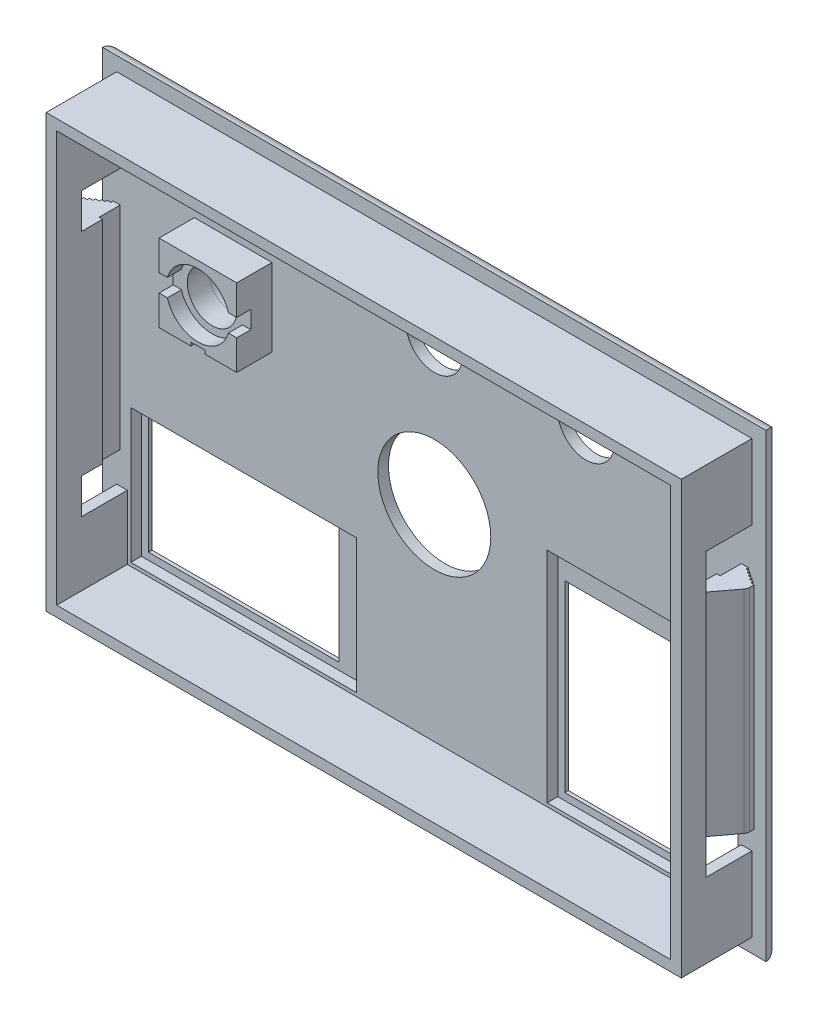
from build123d import *

# Parameters (mm, degrees)
SKETCH_1_W             = 94
SKETCH_1_H             = 65.2
EXTRUDE_1_DEPTH        = 2
SKETCH_2_R             = 8
SKETCH_2_R_2           = 3.5
SKETCH_2_R_3           = 4
SKETCH_2_W             = 27
SKETCH_2_H             = 17
SKETCH_2_W_2           = 25
SKETCH_2_H_2           = 26
CUT_EXTRUDE_1_DEPTH    = 2
SKETCH_3_W             = 90
SKETCH_3_H             = 61.2
SKETCH_3_W_2           = 86
SKETCH_3_H_2           = 57.2
EXTRUDE_2_DEPTH        = 10
SKETCH_4_R             = 9
SKETCH_4_R_2           = 5
CUT_EXTRUDE_4_DEPTH    = 0.5
SKETCH_5_W             = 27
SKETCH_5_H             = 31
SKETCH_5_W_2           = 32
SKETCH_5_H_2           = 19
CUT_EXTRUDE_5_DEPTH    = 1.5
SKETCH_6_W             = 12
SKETCH_6_H             = 12
SKETCH_6_R             = 3.5
EXTRUDE_4_DEPTH        = 5
SKETCH_7_W             = 2
SKETCH_7_H             = 1
CUT_EXTRUDE_6_DEPTH    = 3
CUT_EXTRUDE_7_DEPTH    = 2
SKETCH_10_W            = 6
SKETCH_10_H            = 30
EXTRUDE_5_DEPTH        = 3
CUT_EXTRUDE_9_DEPTH    = 30
CUT_EXTRUDE_10_DEPTH   = 30
CUT_EXTRUDE_11_DEPTH   = 30
FILLET_1_R             = 1
FILLET_2_R             = 2
FILLET_1_OF_MIRROR_9_R = 1
SKETCH_17_R            = 4.5
CUT_EXTRUDE_13_DEPTH   = 2
SKETCH_18_W            = 1.677095884
SKETCH_18_H            = 2.5
CUT_EXTRUDE_14_DEPTH   = 2
SKETCH_19_W            = 1
SKETCH_19_H            = 3
CUT_EXTRUDE_15_DEPTH   = 30
SKETCH_21_W            = 87
SKETCH_21_H            = 58.2
SKETCH_21_W_2          = 86
SKETCH_21_H_2          = 57.2
CUT_EXTRUDE_27_DEPTH   = 10
CUT_EXTRUDE_START      = -7
SKETCH_24_W            = 12
SKETCH_24_H            = 12
SKETCH_24_W_2          = 11
SKETCH_24_H_2          = 11
CUT_EXTRUDE_28_DEPTH   = 7


with BuildPart() as part:
    # 草图1 → 凸台-拉伸1 (new body)
    with BuildSketch(Plane.XY):
        Rectangle(SKETCH_1_W, SKETCH_1_H)
    extrude(amount=EXTRUDE_1_DEPTH)

    # 草图2 → 切除-拉伸1 (cut)
    with BuildSketch(Plane.XY.offset(2)):
        Circle(SKETCH_2_R)
        with Locations((-28.5, 12.7)):
            Circle(SKETCH_2_R_2)
        with Locations((37.5, 20.2)):
            Circle(SKETCH_2_R_3)
        with Locations((21.5, 20.2)):
            Circle(SKETCH_2_R_3)
        with Locations((0, 20.2)):
            Circle(SKETCH_2_R_3)
        with Locations((-28.5, -19.1)):
            Rectangle(SKETCH_2_W, SKETCH_2_H)
        with Locations((29.5, -14.6)):
            Rectangle(SKETCH_2_W_2, SKETCH_2_H_2)
    extrude(amount=-CUT_EXTRUDE_1_DEPTH, mode=Mode.SUBTRACT)

    # 草图3 → 凸台-拉伸2 (add)
    with BuildSketch(Plane.XY.offset(2)):
        Rectangle(SKETCH_3_W, SKETCH_3_H)
        Rectangle(SKETCH_3_W_2, SKETCH_3_H_2, mode=Mode.SUBTRACT)
    extrude(amount=EXTRUDE_2_DEPTH)

    # 草图4 → 切除-拉伸4 (cut)
    with BuildSketch(Plane(origin=(0, 0, 0), x_dir=(-1, 0, 0), z_dir=(0, 0, -1))):
        Circle(SKETCH_4_R)
        with Locations((0, 20.2)):
            Circle(SKETCH_4_R_2)
        with Locations((-21.5, 20.2)):
            Circle(SKETCH_4_R_2)
        with Locations((-37.5, 20.2)):
            Circle(SKETCH_4_R_2)
    extrude(amount=-CUT_EXTRUDE_4_DEPTH, mode=Mode.SUBTRACT)

    # 草图5 → 切除-拉伸5 (cut)
    with BuildSketch(Plane.XY.offset(2)):
        with Locations((29.5, -13.1)):
            Rectangle(SKETCH_5_W, SKETCH_5_H)
        with Locations((-27, -19.1)):
            Rectangle(SKETCH_5_W_2, SKETCH_5_H_2)
    extrude(amount=-CUT_EXTRUDE_5_DEPTH, mode=Mode.SUBTRACT)

    # 草图9 → 切除-拉伸7 (cut)
    with BuildSketch(Plane(origin=(45, 0, 0), x_dir=(0, 0, -1), z_dir=(1, 0, 0))):
        Polygon((-8.5, 20), (-8.5, 15), (-2.5, 15), (-2.5, -15), (-8.5, -15), (-8.5, -20), (-4.518745162, -20), (-2, -20), (-2, 20), align=None)
    cut_extrude_7 = extrude(amount=-CUT_EXTRUDE_7_DEPTH, mode=Mode.SUBTRACT)

    # 草图10 → 凸台-拉伸5 (add)
    with BuildSketch(Plane(origin=(45, 0, 0), x_dir=(0, 0, -1), z_dir=(1, 0, 0))):
        with Locations((-5.5, 0)):
            Rectangle(SKETCH_10_W, SKETCH_10_H)
    extrude_5 = extrude(amount=EXTRUDE_5_DEPTH)

    # 草图13 → 切除-拉伸9 (cut)
    with BuildSketch(Plane(origin=(0, 15, 0), x_dir=(1, 0, 0), z_dir=(0, 1, 0))):
        Polygon((48, -4.5), (48, -2.5), (45, -2.5), (45, -2.837675063), (45.5, -2.837675063), (45.5, -3.168378765), (46, -3.168378765), (46, -3.502957406), (46.5, -3.502957406), (46.5, -3.840024676), (47, -3.840024676), (47, -4.169256843), (47.5, -4.169256843), (47.5, -4.5), align=None)
    cut_extrude_9 = extrude(amount=-CUT_EXTRUDE_9_DEPTH, mode=Mode.SUBTRACT)

    # 草图14 → 切除-拉伸10 (cut)
    with BuildSketch(Plane(origin=(0, 15, 0), x_dir=(1, 0, 0), z_dir=(0, 1, 0))):
        Polygon((45, -8.5), (48, -4.5), (48, -8.5), align=None)
    cut_extrude_10 = extrude(amount=-CUT_EXTRUDE_10_DEPTH, mode=Mode.SUBTRACT)

    # 草图15 → 切除-拉伸11 (cut)
    with BuildSketch(Plane(origin=(0, 15, 0), x_dir=(1, 0, 0), z_dir=(0, 1, 0))):
        Polygon((47.5, -4.5), (47.5, -5.166666667), (48, -4.5), align=None)
    cut_extrude_11 = extrude(amount=-CUT_EXTRUDE_11_DEPTH, mode=Mode.SUBTRACT)

    # 圆角1
    fillet_1_edges = [part.edges().sort_by_distance(p)[0] for p in [
        (47.5, 0, 5.166666667),
    ]]
    fillet(fillet_1_edges, radius=FILLET_1_R)

    # 圆角2
    fillet_2_edges = [part.edges().sort_by_distance(p)[0] for p in [
        (47, 0, 0),
        (0, -32.6, 0),
        (-47, 0, 0),
        (0, 32.6, 0),
    ]]
    fillet(fillet_2_edges, radius=FILLET_2_R - 0.0001)  # a hair under: the kernel refuses the full size

    # 镜向9: 切除-拉伸7, 凸台-拉伸5, 切除-拉伸9, 切除-拉伸10, 切除-拉伸11 across plane
    add(cut_extrude_7.mirror(Plane(origin=(0, 0, 0), x_dir=(0, 0, 1), z_dir=(1, 0, 0))), mode=Mode.SUBTRACT)
    add(extrude_5.mirror(Plane(origin=(0, 0, 0), x_dir=(0, 0, 1), z_dir=(1, 0, 0))))
    add(cut_extrude_9.mirror(Plane(origin=(0, 0, 0), x_dir=(0, 0, 1), z_dir=(1, 0, 0))), mode=Mode.SUBTRACT)
    add(cut_extrude_10.mirror(Plane(origin=(0, 0, 0), x_dir=(0, 0, 1), z_dir=(1, 0, 0))), mode=Mode.SUBTRACT)
    add(cut_extrude_11.mirror(Plane(origin=(0, 0, 0), x_dir=(0, 0, 1), z_dir=(1, 0, 0))), mode=Mode.SUBTRACT)

    # 圆角1 of 镜向9
    fillet_1_of_mirror_9_edges = [part.edges().sort_by_distance(p)[0] for p in [
        (-47.5, 0, 5.166666667),
    ]]
    fillet(fillet_1_of_mirror_9_edges, radius=FILLET_1_OF_MIRROR_9_R)

    # 草图19 → 切除-拉伸15 (cut)
    with BuildSketch(Plane(origin=(0, 15, 0), x_dir=(1, 0, 0), z_dir=(0, 1, 0))):
        with Locations((43.5, -4)):
            Rectangle(SKETCH_19_W, SKETCH_19_H)
    cut_extrude_15 = extrude(amount=-CUT_EXTRUDE_15_DEPTH, mode=Mode.SUBTRACT)

    # 镜向11: 切除-拉伸15 across plane
    add(cut_extrude_15.mirror(Plane(origin=(0, 0, 0), x_dir=(0, 0, 1), z_dir=(1, 0, 0))), mode=Mode.SUBTRACT)

    # 草图21 → 切除-拉伸27 (cut)
    with BuildSketch(Plane.XY.offset(12)):
        Rectangle(SKETCH_21_W, SKETCH_21_H)
        Rectangle(SKETCH_21_W_2, SKETCH_21_H_2, mode=Mode.SUBTRACT)
    extrude(amount=-CUT_EXTRUDE_27_DEPTH, mode=Mode.SUBTRACT)


with BuildPart() as body_2:
    # 草图6 → 凸台-拉伸4 (new body)
    with BuildSketch(Plane.XY.offset(2)):
        with Locations((-28.5, 12.7)):
            Rectangle(SKETCH_6_W, SKETCH_6_H)
        with Locations((-28.5, 12.7)):
            Circle(SKETCH_6_R, mode=Mode.SUBTRACT)
    extrude(amount=EXTRUDE_4_DEPTH)

    # 草图7 → 切除-拉伸6 (cut)
    with BuildSketch(Plane.XY.offset(7)):
        with Locations((-28.5, 7.2)):
            Rectangle(SKETCH_7_W, SKETCH_7_H)
    extrude(amount=-CUT_EXTRUDE_6_DEPTH, mode=Mode.SUBTRACT)

    # 草图17 → 切除-拉伸13 (cut)
    with BuildSketch(Plane.XY.offset(7)):
        with Locations((-28.5, 12.7)):
            Circle(SKETCH_17_R)
    extrude(amount=-CUT_EXTRUDE_13_DEPTH, mode=Mode.SUBTRACT)

    # 草图18 → 切除-拉伸14 (cut)
    with BuildSketch(Plane.XY.offset(7)):
        with Locations((-33.661452058, 12.7)):
            Rectangle(SKETCH_18_W, SKETCH_18_H)
    cut_extrude_14 = extrude(amount=-CUT_EXTRUDE_14_DEPTH, mode=Mode.SUBTRACT)

    # 镜向10: 切除-拉伸14 across plane
    add(cut_extrude_14.mirror(Plane(origin=(-28.5, 0, 0), x_dir=(0, 0, 1), z_dir=(1, 0, 0))), mode=Mode.SUBTRACT)

    # 草图24 → 切除-拉伸28 (cut)
    with BuildSketch(Plane.XY.offset(7).offset(CUT_EXTRUDE_START)):
        with Locations((-28.5, 12.7)):
            Rectangle(SKETCH_24_W, SKETCH_24_H)
        with Locations((-28.5, 12.7)):
            Rectangle(SKETCH_24_W_2, SKETCH_24_H_2, mode=Mode.SUBTRACT)
    extrude(amount=CUT_EXTRUDE_28_DEPTH, mode=Mode.SUBTRACT)


solid = Compound([part.part, body_2.part])
